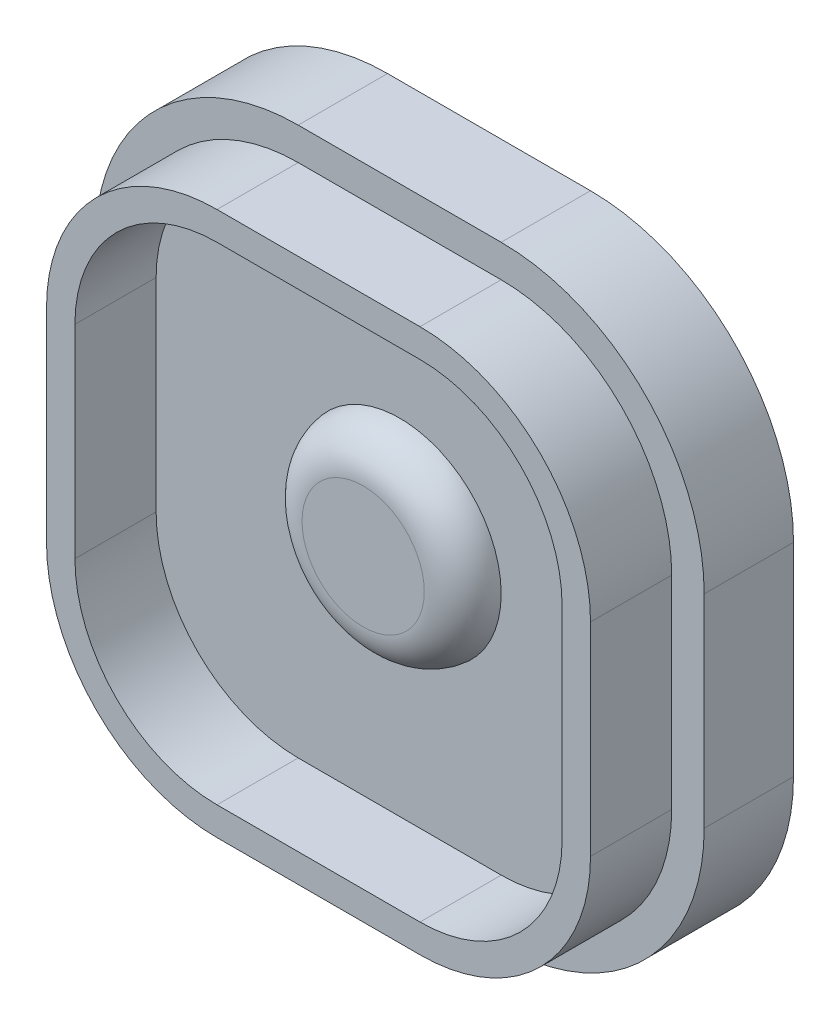
from build123d import *

# Parameters (mm, degrees)
SKETCH1_R           = 6.35
BOSS_EXTRUDE1_DEPTH = 6.096
BOSS_EXTRUDE2_DEPTH = 1.778
CUT_EXTRUDE1_START  = -1.778
CUT_EXTRUDE1_DEPTH  = 1.778
SKETCH5_R           = 6.35
BOSS_EXTRUDE3_DEPTH = 1.778
FILLET2_R           = 2.54
BOSS_EXTRUDE5_START = 3.81
BOSS_EXTRUDE5_DEPTH = 3.81
BOSS_EXTRUDE6_DEPTH = 5.08


with BuildPart() as part:
    # Sketch1 → Boss-Extrude1 (new body)
    with BuildSketch(Plane.XY):
        with Locations(Location((0, 0, 0), (0, 0, 180))):
            Circle(SKETCH1_R)
        with BuildLine():
            Line((-1.778, 2.155261469), (-1.778, -2.155261469))
            ThreePointArc((-1.778, -2.155261469), (0, -2.794), (1.778, -2.155261469))
            Line((1.778, -2.155261469), (1.778, 2.155261469))
            ThreePointArc((1.778, 2.155261469), (0, 2.794), (-1.778, 2.155261469))
        make_face(mode=Mode.SUBTRACT)
    extrude(amount=BOSS_EXTRUDE1_DEPTH)

    # Sketch3 → Boss-Extrude2 (add)
    with BuildSketch(Plane.XY.offset(3.81)):
        with BuildLine():
            Line((-6.35, 19.05), (6.35, 19.05))
            ThreePointArc((6.35, 19.05), (15.330256121, 15.330256121), (19.05, 6.35))
            Line((19.05, 6.35), (19.05, -6.35))
            ThreePointArc((19.05, -6.35), (15.330256121, -15.330256121), (6.35, -19.05))
            Line((6.35, -19.05), (-6.35, -19.05))
            ThreePointArc((-6.35, -19.05), (-15.330256121, -15.330256121), (-19.05, -6.35))
            Line((-19.05, -6.35), (-19.05, 6.35))
            ThreePointArc((-19.05, 6.35), (-15.330256121, 15.330256121), (-6.35, 19.05))
        make_face()
    extrude(amount=BOSS_EXTRUDE2_DEPTH)

    # Sketch4 → Cut-Extrude1 (cut)
    with BuildSketch(Plane.XY.offset(5.588).offset(CUT_EXTRUDE1_START)):
        with BuildLine():
            Line((-1.778, 2.155261469), (-1.778, -2.155261469))
            ThreePointArc((-1.778, -2.155261469), (0, -2.794), (1.778, -2.155261469))
            Line((1.778, -2.155261469), (1.778, 2.155261469))
            ThreePointArc((1.778, 2.155261469), (0, 2.794), (-1.778, 2.155261469))
        make_face()
    extrude(amount=CUT_EXTRUDE1_DEPTH, mode=Mode.SUBTRACT)

    # Sketch5 → Boss-Extrude3 (add)
    with BuildSketch(Plane.XY.offset(6.096)):
        with Locations(Location((0, 0, 0), (0, 0, 180))):
            Circle(SKETCH5_R)
    extrude(amount=BOSS_EXTRUDE3_DEPTH)

    # Fillet2
    # the kernel refuses this fillet: 2.54 mm, written as the material it takes off along each edge
    with BuildSketch(Plane(origin=(0, 0, 7.874), x_dir=(-1, 0, 0), z_dir=(0, 1, 0))) as fillet2_piece_1:
        with BuildLine():
            CenterArc((3.82273191, -2.54), FILLET2_R, 5.739170477, 84.260829523)
            Line((3.82273191, 0), (3.82273191, 0.0508))
            Line((3.82273191, 0.0508), (6.35, 0.0508))
            Line((6.35, 0.0508), (6.4008, 0))
            ThreePointArc((6.4008, 0), (6.4008, -1.143), (6.400545362, -2.28092))
            Line((6.400545362, -2.28092), (6.35, -2.286))
        make_face()
    revolve(axis=Axis((0, 0, 7.874), (0, 0, 1)), mode=Mode.SUBTRACT)

    # Sketch6 → Boss-Extrude5 (add)
    with BuildSketch(Plane(origin=(0, 0, 3.81), x_dir=(-1, 0, 0), z_dir=(0, 0, -1)).offset(BOSS_EXTRUDE5_START)):
        with BuildLine():
            Line((-6.35, 19.05), (6.35, 19.05))
            ThreePointArc((6.35, 19.05), (15.330256121, 15.330256121), (19.05, 6.35))
            Line((19.05, 6.35), (19.05, -6.35))
            ThreePointArc((19.05, -6.35), (15.330256121, -15.330256121), (6.35, -19.05))
            Line((6.35, -19.05), (-6.35, -19.05))
            ThreePointArc((-6.35, -19.05), (-15.330256121, -15.330256121), (-19.05, -6.35))
            Line((-19.05, -6.35), (-19.05, 6.35))
            ThreePointArc((-19.05, 6.35), (-15.330256121, 15.330256121), (-6.35, 19.05))
        make_face()
        with BuildLine():
            Line((-17.272, 6.35), (-17.272, -6.35))
            ThreePointArc((-17.272, -6.35), (-14.073020264, -14.073020264), (-6.35, -17.272))
            Line((-6.35, -17.272), (6.35, -17.272))
            ThreePointArc((6.35, -17.272), (14.073020264, -14.073020264), (17.272, -6.35))
            Line((17.272, -6.35), (17.272, 6.35))
            ThreePointArc((17.272, 6.35), (14.073020264, 14.073020264), (6.35, 17.272))
            Line((6.35, 17.272), (-6.35, 17.272))
            ThreePointArc((-6.35, 17.272), (-14.073020264, 14.073020264), (-17.272, 6.35))
        make_face(mode=Mode.SUBTRACT)
    extrude(amount=-BOSS_EXTRUDE5_DEPTH)

    # Sketch7 → Boss-Extrude6 (add)
    with BuildSketch(Plane.XY.offset(5.588)):
        with BuildLine():
            Line((-6.35, 17.018), (6.35, 17.018))
            ThreePointArc((6.35, 17.018), (13.893415142, 13.893415142), (17.018, 6.35))
            Line((17.018, 6.35), (17.018, -6.35))
            ThreePointArc((17.018, -6.35), (13.893415142, -13.893415142), (6.35, -17.018))
            Line((6.35, -17.018), (-6.35, -17.018))
            ThreePointArc((-6.35, -17.018), (-13.893415142, -13.893415142), (-17.018, -6.35))
            Line((-17.018, -6.35), (-17.018, 6.35))
            ThreePointArc((-17.018, 6.35), (-13.893415142, 13.893415142), (-6.35, 17.018))
        make_face()
        with BuildLine():
            ThreePointArc((-6.35, 15.24), (-12.636179285, 12.636179285), (-15.24, 6.35))
            Line((-15.24, 6.35), (-15.24, -6.35))
            ThreePointArc((-15.24, -6.35), (-12.636179285, -12.636179285), (-6.35, -15.24))
            Line((-6.35, -15.24), (6.35, -15.24))
            ThreePointArc((6.35, -15.24), (12.636179285, -12.636179285), (15.24, -6.35))
            Line((15.24, -6.35), (15.24, 6.35))
            ThreePointArc((15.24, 6.35), (12.636179285, 12.636179285), (6.35, 15.24))
            Line((6.35, 15.24), (-6.35, 15.24))
        make_face(mode=Mode.SUBTRACT)
    extrude(amount=BOSS_EXTRUDE6_DEPTH)


solid = part.part
